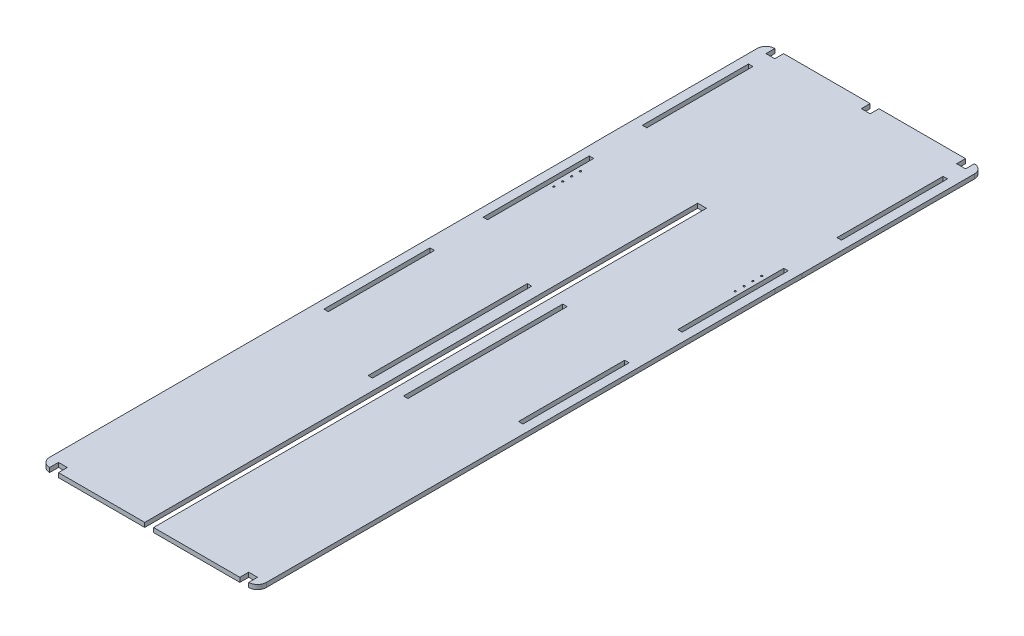
from build123d import *

# Parameters (mm, degrees)
SKETCH2_W           = 5
SKETCH2_H           = 120
BOSS_EXTRUDE1_DEPTH = 5
SKETCH3_R           = 1
SKETCH3_W           = 5
SKETCH3_H           = 180
CUT_EXTRUDE1_DEPTH  = 5
FILLET1_R           = 10
SKETCH4_W           = 10
SKETCH4_H           = 10
CUT_EXTRUDE2_DEPTH  = 10


with BuildPart() as part:
    # Sketch2 → Boss-Extrude1 (new body)
    with BuildSketch(Plane(origin=(0, 0, 0), x_dir=(1, 0, 0), z_dir=(0, 1, 0))):
        Polygon((0, 375), (0, 0), (0, -230), (10, -230), (15, -230), (117.5, -230), (117.5, 395), (127.5, 395), (127.5, -230), (230, -230), (235, -230), (245, -230), (245, -10), (245, 355), (245.3, 385), (245.3, 590), (245, 590), (0, 590), (-0.3, 590), (-0.3, 405), align=None)
        with Locations((12.5, 140)):
            Rectangle(SKETCH2_W, SKETCH2_H, mode=Mode.SUBTRACT)
        with Locations((232.5, 140)):
            Rectangle(SKETCH2_W, SKETCH2_H, mode=Mode.SUBTRACT)
        with Locations((12.5, 320)):
            Rectangle(SKETCH2_W, SKETCH2_H, mode=Mode.SUBTRACT)
        with Locations((12.5, 500)):
            Rectangle(SKETCH2_W, SKETCH2_H, mode=Mode.SUBTRACT)
        with Locations((232.5, 320)):
            Rectangle(SKETCH2_W, SKETCH2_H, mode=Mode.SUBTRACT)
        with Locations((232.5, 500)):
            Rectangle(SKETCH2_W, SKETCH2_H, mode=Mode.SUBTRACT)
    extrude(amount=BOSS_EXTRUDE1_DEPTH)

    # Sketch3 → Cut-Extrude1 (cut)
    with BuildSketch(Plane(origin=(0, 5, 0), x_dir=(1, 0, 0), z_dir=(0, 1, 0))):
        with Locations((20, 330)):
            Circle(SKETCH3_R)
        with Locations((20, 340)):
            Circle(SKETCH3_R)
        with Locations((20, 350)):
            Circle(SKETCH3_R)
        with Locations((20, 360)):
            Circle(SKETCH3_R)
        with Locations((102.5, 130)):
            Rectangle(SKETCH3_W, SKETCH3_H)
    cut_extrude1 = extrude(amount=-CUT_EXTRUDE1_DEPTH, mode=Mode.SUBTRACT)

    # Mirror1: Cut-Extrude1 across plane
    add(cut_extrude1.mirror(Plane.ZY.offset(-122.5)), mode=Mode.SUBTRACT)

    # Fillet1
    fillet1_edges = [part.edges().sort_by_distance(p)[0] for p in [
        (245.3, 2.5, -590),
        (-0.3, 2.5, -590),
        (0, 2.5, 230),
        (245, 2.5, 230),
    ]]
    fillet(fillet1_edges, radius=FILLET1_R)

    # Sketch4 → Cut-Extrude2 (cut)
    with BuildSketch(Plane(origin=(0, 5, 0), x_dir=(1, 0, 0), z_dir=(0, 1, 0))):
        with Locations((15, -225)):
            Rectangle(SKETCH4_W, SKETCH4_H)
        with Locations((230, -225)):
            Rectangle(SKETCH4_W, SKETCH4_H)
        with Locations((14.7, 585)):
            Rectangle(SKETCH4_W, SKETCH4_H)
        with Locations((230.3, 585)):
            Rectangle(SKETCH4_W, SKETCH4_H)
        with Locations((122.5, 585)):
            Rectangle(SKETCH4_W, SKETCH4_H)
    extrude(amount=-CUT_EXTRUDE2_DEPTH, mode=Mode.SUBTRACT)


solid = part.part
